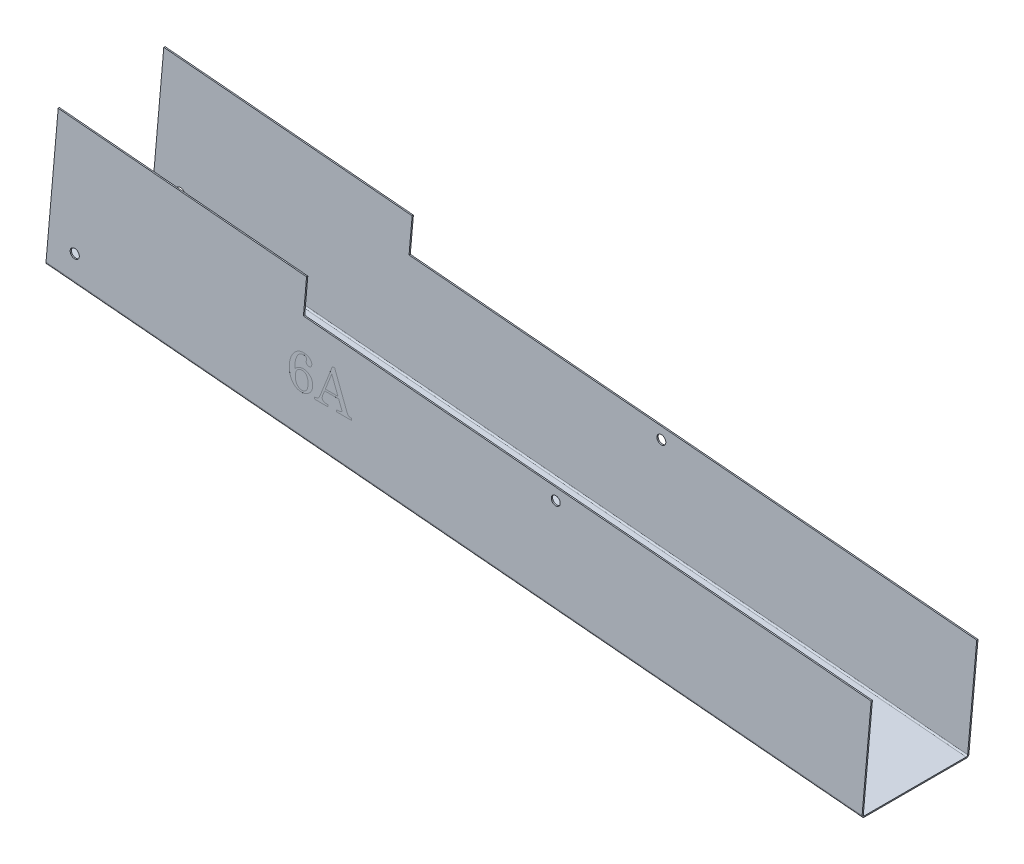
from build123d import *

# Parameters (mm, degrees)
BOSS_EXTRUDE1_DEPTH  = 38.1
CONVERT_SOLID1_START = -55.710785074
CONVERT_SOLID1_DEPTH = 584.2
SKETCH7_R            = 3.2639
CUT_EXTRUDE1_DEPTH   = 546.036793039
SKETCH8_R            = 3.175
CUT_EXTRUDE2_DEPTH   = 546.036793039
CUT_EXTRUDE3_DEPTH   = 0.00254
CUT_EXTRUDE4_DEPTH   = 0.00254


# Read off the part's stored shape, not the designer's step: Convert-Solid1
with BuildPart() as part:
    # Sketch1 → Boss-Extrude1 (new, symmetric)
    with BuildSketch(Plane.XY):
        Polygon((-47.909661455, 91.599636392), (-56.764684918, -9.613744934), (525.212257707, -60.530129847), (531.853525304, 15.379906147), (127, 50.8), (129.213755866, 76.103345332), align=None)
    extrude(amount=BOSS_EXTRUDE1_DEPTH, both=True)

    # Convert-Solid1 outline → Convert-Solid1 (cut)
    with BuildSketch(Plane(origin=(0, 0, 0), x_dir=(0.08715574274766531, 0.9961946980917449, 0), z_dir=(0.996194698091745, -0.0871557427476653, 0)).offset(CONVERT_SOLID1_START)):
        with BuildLine():
            Line((-14.524530008, -38.1), (-12.624530008, -38.1))
            ThreePointArc((-12.624530008, -38.1), (-13.968032892, -37.543502884), (-14.524530008, -36.2))
            Line((-14.524530008, -36.2), (-14.524530008, -38.1))
        make_face()
        with BuildLine():
            Line((-14.524530008, 38.1), (-14.524530008, 36.2))
            ThreePointArc((-14.524530008, 36.2), (-13.968032892, 37.543502884), (-12.624530008, 38.1))
            Line((-12.624530008, 38.1), (-14.524530008, 38.1))
        make_face()
        with BuildLine():
            Line((87.075469992, 37.2), (-12.624530008, 37.2))
            ThreePointArc((-12.624530008, 37.2), (-13.331636789, 36.907106781), (-13.624530008, 36.2))
            Line((-13.624530008, 36.2), (-13.624530008, -36.2))
            ThreePointArc((-13.624530008, -36.2), (-13.331636789, -36.907106781), (-12.624530008, -37.2))
            Line((-12.624530008, -37.2), (87.075469992, -37.2))
            Line((87.075469992, -37.2), (87.075469992, 37.2))
        make_face()
    extrude(amount=CONVERT_SOLID1_DEPTH, mode=Mode.SUBTRACT)

    # Sketch7 → Cut-Extrude1 (cut, through all)
    with BuildSketch(Plane.XY.offset(38.1)):
        with Locations((-36.12685902, 7.703447165)):
            Circle(SKETCH7_R)
    extrude(amount=-CUT_EXTRUDE1_DEPTH, mode=Mode.SUBTRACT)

    # Sketch8 → Cut-Extrude2 (cut, through all)
    with BuildSketch(Plane.XY.offset(38.1)):
        with Locations((306.935346231, 26.643679159)):
            Circle(SKETCH8_R)
    extrude(amount=-CUT_EXTRUDE2_DEPTH, mode=Mode.SUBTRACT)

    # Sketch9 → Cut-Extrude3 (cut)
    # profile 1 of 2: a face of its own
    with BuildSketch(Plane.XY.offset(38.1)):
        with BuildLine():
            add(Edge.make_bspline(
                [(120.89433467, 15.089818668), (121.114088216, 15.345842173), (121.538987526, 15.84087041), (122.239142865, 16.478252848), (122.947738879, 17.012514754), (123.685172025, 17.424471298), (124.448056146, 17.737639932), (125.244133896, 17.954884337), (126.074937094, 18.098576279), (126.642739319, 18.111886686), (126.931063967, 18.118645585)],
                knots=[0, 0, 0, 0, 1.15518856, 2.233587714, 3.237434965, 4.189814948, 5.119660525, 6.056163246, 7.012937916, 8, 8, 8, 8], degree=3))
            add(Edge.make_bspline(
                [(126.931063967, 18.118645585), (127.163238148, 18.112284528), (127.620591221, 18.099754068), (128.29214448, 18.010660977), (128.932918228, 17.85788295), (129.545550895, 17.648311787), (130.12936233, 17.374335257), (130.684310045, 17.038368848), (131.209872932, 16.643910291), (131.699402491, 16.194529218), (132.148553243, 15.700862071), (132.540479297, 15.167432489), (132.874213134, 14.601651518), (133.146086261, 14.005552071), (133.356564242, 13.37582201), (133.508305237, 12.71563057), (133.597815675, 12.021595347), (133.610164696, 11.548600634), (133.61645395, 11.307708372)],
                knots=[0, 0, 0, 0, 1.044483906, 2.057498042, 3.041291563, 4.003930521, 4.965577941, 5.937000168, 6.91766058, 7.91718785, 8.922517361, 9.915774843, 10.889917702, 11.872928882, 12.857847881, 13.872197807, 14.916328091, 16, 16, 16, 16], degree=3))
            add(Edge.make_bspline(
                [(133.61645395, 11.307708372), (133.609686304, 11.017895276), (133.596385906, 10.448328055), (133.483616416, 9.61279963), (133.301132484, 8.813883659), (133.045838083, 8.052003737), (132.710298625, 7.331231644), (132.315625768, 6.64081832), (131.8332376, 5.995787294), (131.288239774, 5.393593114), (130.690518139, 4.847402727), (130.052725185, 4.367876698), (129.382722594, 3.955558889), (128.672045171, 3.626901354), (127.92937851, 3.36772925), (127.150897581, 3.185953045), (126.338023915, 3.073225948), (125.784071212, 3.059794099), (125.502964228, 3.052978017)],
                knots=[0, 0, 0, 0, 1.07530773, 2.113293164, 3.12278084, 4.113357206, 5.089279015, 6.06946209, 7.059700115, 8.072336363, 9.080183726, 10.060046246, 11.030156511, 11.994333323, 12.960419743, 13.944696705, 14.957022674, 16, 16, 16, 16], degree=3))
            add(Edge.make_bspline(
                [(125.502964228, 3.052978017), (125.304061517, 3.057454939), (124.908926153, 3.066348686), (124.324681697, 3.123431469), (123.756354494, 3.223199846), (123.205251831, 3.364469743), (122.672483705, 3.548125618), (122.154554857, 3.769465775), (121.655023023, 4.030885581), (121.168837033, 4.328423089), (120.708922701, 4.678109496), (120.263810831, 5.063060629), (119.840877966, 5.496050146), (119.448244789, 5.978187153), (119.066250246, 6.499042192), (118.71286809, 7.068173056), (118.38559757, 7.684367309), (118.068548348, 8.335418597), (117.790022952, 9.028342888), (117.54227243, 9.750379894), (117.338828372, 10.502308298), (117.173384272, 11.283468466), (117.035734652, 12.09094296), (116.941694516, 12.927457627), (116.89120147, 13.791866187), (116.881670292, 14.378323006), (116.876823319, 14.676559037)],
                knots=[0, 0, 0, 0, 0.883664919, 1.755467568, 2.604957291, 3.444820255, 4.280205446, 5.10616279, 5.944667041, 6.78306393, 7.635198672, 8.508239482, 9.395699299, 10.320121956, 11.268418048, 12.263647801, 13.293052967, 14.36716297, 15.479155568, 16.608498161, 17.756732724, 18.93730736, 20.154818251, 21.394408002, 22.674955442, 24, 24, 24, 24], degree=3))
            add(Edge.make_bspline(
                [(116.876823319, 14.676559037), (116.879795062, 14.999310792), (116.885682298, 15.638705063), (116.964354993, 16.58458207), (117.076561814, 17.508641461), (117.239549394, 18.409711468), (117.447659024, 19.288560268), (117.70547884, 20.14408514), (118.007541987, 20.976273219), (118.359398486, 21.779578654), (118.742311348, 22.548520564), (119.156679594, 23.273169608), (119.595775586, 23.946767655), (120.054859622, 24.575152907), (120.550070596, 25.143488446), (121.062833494, 25.672377905), (121.606648962, 26.146162918), (122.171958031, 26.573044987), (122.757389031, 26.939072232), (123.345664192, 27.267979694), (123.942631825, 27.546846434), (124.548402267, 27.771132326), (125.159184512, 27.944228183), (125.774104456, 28.072129569), (126.397429482, 28.145846084), (126.815794682, 28.156893654), (127.025224389, 28.162423964)],
                knots=[0, 0, 0, 0, 1.243152028, 2.46277293, 3.654372621, 4.828515876, 5.988718833, 7.132190138, 8.269229334, 9.397502021, 10.509151182, 11.577424797, 12.611608541, 13.605920474, 14.572893715, 15.513533556, 16.441930275, 17.348883295, 18.239769449, 19.09980024, 19.944394787, 20.775522359, 21.585751549, 22.388144142, 23.193120032, 24, 24, 24, 24], degree=3))
            add(Edge.make_bspline(
                [(127.025224389, 28.162423964), (127.238174697, 28.1591137), (127.656494255, 28.152611019), (128.27159921, 28.080233526), (128.862173988, 27.974474479), (129.427448228, 27.815460512), (129.967153936, 27.609857442), (130.484481983, 27.365642764), (130.977785124, 27.076365615), (131.281908372, 26.84888696), (131.435070833, 26.734324226)],
                knots=[0, 0, 0, 0, 1.081133678, 2.12377886, 3.141755168, 4.125997766, 5.101473931, 6.072112995, 7.02907811, 8, 8, 8, 8], degree=3))
            add(Edge.make_bspline(
                [(131.435070833, 26.734324226), (131.556118645, 26.637674953), (131.791012042, 26.450126944), (132.093665211, 26.130511832), (132.359338027, 25.806834142), (132.57721842, 25.465780445), (132.738194152, 25.104665569), (132.862683979, 24.732512785), (132.92905444, 24.342537395), (132.940903712, 24.078864435), (132.946868725, 23.946129499)],
                knots=[0, 0, 0, 0, 1.127905394, 2.18870153, 3.201176125, 4.178074235, 5.128053522, 6.076756242, 7.031824741, 8, 8, 8, 8], degree=3))
            add(Edge.make_bspline(
                [(132.946868725, 23.946129499), (132.940934165, 23.772757525), (132.929459535, 23.437538185), (132.809857183, 22.959684222), (132.622032994, 22.528966739), (132.359386265, 22.156225366), (132.041755783, 21.853445533), (131.686041661, 21.626813492), (131.291524368, 21.487637331), (131.015954788, 21.473689099), (130.875339434, 21.466571712)],
                knots=[0, 0, 0, 0, 1.153726211, 2.230760421, 3.261177434, 4.270660677, 5.249146575, 6.168386457, 7.065379467, 8, 8, 8, 8], degree=3))
            add(Edge.make_bspline(
                [(130.875339434, 21.466571712), (130.745421838, 21.473205795), (130.489441424, 21.486277121), (130.123644536, 21.602352262), (129.783907126, 21.78179695), (129.490802603, 22.041273433), (129.242868395, 22.342459386), (129.057804204, 22.680395021), (128.951365556, 23.047000786), (128.936743618, 23.300295722), (128.929357373, 23.428247176)],
                knots=[0, 0, 0, 0, 1.014689736, 1.999272662, 2.976541523, 4.002645451, 5.040935778, 6.018204639, 6.998899853, 8, 8, 8, 8], degree=3))
            add(Edge.make_bspline(
                [(128.929357373, 23.428247176), (128.937531178, 23.61911687), (128.954945449, 24.025764249), (129.051010302, 24.421448019), (129.101984814, 24.631408128)],
                knots=[0, 0, 0, 0, 0.938747937, 2, 2, 2, 2], degree=3))
            add(Edge.make_bspline(
                [(129.101984814, 24.631408128), (129.128139219, 24.728686237), (129.177312618, 24.91158068), (129.220288065, 25.173132084), (129.257050947, 25.399394124), (129.261911749, 25.539763682), (129.264149986, 25.604399158)],
                knots=[0, 0, 0, 0, 1.221676289, 2.296897074, 3.215778188, 4, 4, 4, 4], degree=3))
            add(Edge.make_bspline(
                [(129.264149986, 25.604399158), (129.260239071, 25.683868784), (129.252494311, 25.841241978), (129.155915195, 26.059883442), (129.008694851, 26.258592567), (128.874930162, 26.360854425), (128.803810143, 26.415225017)],
                knots=[0, 0, 0, 0, 0.975009045, 1.930804205, 2.899849836, 4, 4, 4, 4], degree=3))
            add(Edge.make_bspline(
                [(128.803810143, 26.415225017), (128.694040529, 26.478382471), (128.464525254, 26.610437235), (128.063622259, 26.738987531), (127.606622277, 26.808198673), (127.283547461, 26.81807512), (127.114153677, 26.823253514)],
                knots=[0, 0, 0, 0, 0.860759205, 1.799745656, 2.846368109, 4, 4, 4, 4], degree=3))
            add(Edge.make_bspline(
                [(127.114153677, 26.823253514), (126.842478379, 26.812682502), (126.305474194, 26.791787421), (125.52393702, 26.578232915), (124.775576183, 26.253866271), (124.195066778, 25.866797314), (123.750323222, 25.495986708), (123.429501375, 25.161431408), (123.123489829, 24.780346822), (122.829315951, 24.35297439), (122.547689992, 23.88055804), (122.273808486, 23.361640789), (122.021011662, 22.792264893), (121.697322407, 21.96867417), (121.348902277, 20.869822693), (121.054298255, 19.475479799), (120.871628266, 18.001446734), (120.852051293, 16.9927546), (120.842023324, 16.47606933)],
                knots=[0, 0, 0, 0, 0.971688549, 1.920678183, 2.88340009, 3.885392209, 4.408774106, 4.956875509, 5.543534456, 6.159017994, 6.815026857, 7.513966368, 8.260917618, 9.046686804, 10.685410247, 12.385720898, 14.148647427, 16, 16, 16, 16], degree=3))
            add(Edge.make_bspline(
                [(120.842023324, 16.47606933), (120.843519451, 16.388877473), (120.846811567, 16.197018209), (120.858210949, 15.879669817), (120.873722498, 15.50475786), (120.887145755, 15.234537162), (120.89433467, 15.089818668)],
                knots=[0, 0, 0, 0, 0.754292582, 1.659765325, 2.74667174, 4, 4, 4, 4], degree=3))
        make_face()
        with BuildLine():
            add(Edge.make_bspline(
                [(126.026077686, 16.779475135), (125.854902559, 16.774308519), (125.517943655, 16.764138016), (125.023958287, 16.687928154), (124.551939118, 16.571718788), (124.10565542, 16.39362446), (123.683148695, 16.171247458), (123.287322107, 15.893874221), (122.912819959, 15.572690993), (122.565004715, 15.203346794), (122.248748804, 14.789144223), (121.979085552, 14.330231455), (121.739319201, 13.837515065), (121.553371588, 13.299321711), (121.407532431, 12.723409035), (121.303834923, 12.107643488), (121.240246332, 11.452037247), (121.232904463, 11.000965095), (121.229127283, 10.768901511)],
                knots=[0, 0, 0, 0, 0.949075543, 1.868258902, 2.766701683, 3.639584075, 4.526552555, 5.40923933, 6.314579547, 7.258763553, 8.218230028, 9.198529645, 10.206493817, 11.252665883, 12.350497027, 13.498519192, 14.713060431, 16, 16, 16, 16], degree=3))
            add(Edge.make_bspline(
                [(121.229127283, 10.768901511), (121.232749537, 10.517649445), (121.239779729, 10.030011014), (121.30516682, 9.322720062), (121.401798309, 8.65971962), (121.542090852, 8.041833853), (121.724073329, 7.46865906), (121.949920046, 6.943837268), (122.212280471, 6.462369512), (122.514301665, 6.029169454), (122.851721578, 5.645596454), (123.211928673, 5.309606024), (123.595871941, 5.0245511), (124.001398316, 4.792589912), (124.429621987, 4.611551014), (124.882162154, 4.4890596), (125.355218696, 4.406111839), (125.678716257, 4.396851074), (125.842987976, 4.392148468)],
                knots=[0, 0, 0, 0, 1.364103527, 2.647497837, 3.854117083, 5.000370457, 6.084428247, 7.115189779, 8.098401111, 9.057233799, 9.976535432, 10.867705672, 11.727535847, 12.567318146, 13.399161598, 14.244637041, 15.108628548, 16, 16, 16, 16], degree=3))
            add(Edge.make_bspline(
                [(125.842987976, 4.392148468), (126.00544655, 4.397281487), (126.323338108, 4.407325545), (126.788167355, 4.483037976), (127.228797586, 4.60256894), (127.646930508, 4.769611707), (128.036143754, 4.993838658), (128.404089562, 5.260661072), (128.745622388, 5.57744355), (129.061438817, 5.941976285), (129.349842295, 6.353393312), (129.594855368, 6.818786296), (129.803798756, 7.328787751), (129.977021702, 7.885022026), (130.105756984, 8.49123243), (130.197838849, 9.143227635), (130.256553463, 9.843677169), (130.264445025, 10.325877272), (130.268527824, 10.575349532)],
                knots=[0, 0, 0, 0, 0.909396033, 1.779464838, 2.629860702, 3.462124791, 4.29295567, 5.138629575, 6.002374521, 6.895212095, 7.835129073, 8.809266767, 9.833779316, 10.917798107, 12.066925648, 13.300059089, 14.603151772, 16, 16, 16, 16], degree=3))
            add(Edge.make_bspline(
                [(130.268527824, 10.575349532), (130.266169319, 10.83874703), (130.261618983, 11.346928015), (130.208509273, 12.082189126), (130.122185612, 12.762214572), (129.997104982, 13.384344116), (129.841473688, 13.950482474), (129.6480721, 14.46066289), (129.420861428, 14.916567413), (129.154404219, 15.314890708), (128.860622905, 15.663644687), (128.534544894, 15.963092807), (128.182647247, 16.215046988), (127.803990565, 16.423842221), (127.397611977, 16.584022361), (126.964235824, 16.699784395), (126.504393924, 16.769561835), (126.188494273, 16.776108985), (126.026077686, 16.779475135)],
                knots=[0, 0, 0, 0, 1.481997958, 2.859264748, 4.145766163, 5.336979382, 6.427417082, 7.446135251, 8.402802757, 9.287300334, 10.136644771, 10.963063103, 11.771815852, 12.566698608, 13.39031591, 14.223406735, 15.086582672, 16, 16, 16, 16], degree=3))
        make_face(mode=Mode.SUBTRACT)
    # profile 2 of 2: a face of its own
    with BuildSketch(Plane.XY.offset(38.1)):
        with BuildLine():
            Line((147.667281411, 29.836387027), (149.252315186, 29.836387027))
            Line((149.252315186, 29.836387027), (158.281253458, 6.191658761))
            add(Edge.make_bspline(
                [(158.281253458, 6.191658761), (158.331763824, 6.074710298), (158.428767939, 5.850113185), (158.629710333, 5.549230252), (158.862347869, 5.289883042), (159.141675612, 5.086518511), (159.448382854, 4.916329442), (159.80059728, 4.8143571), (160.183515277, 4.734026653), (160.453420453, 4.729361041), (160.593414939, 4.72694108)],
                knots=[0, 0, 0, 0, 1.039787226, 1.996889935, 2.945563617, 3.872445737, 4.810232727, 5.797866669, 6.857796924, 8, 8, 8, 8], degree=3))
            Line((160.593414939, 4.72694108), (161.404240798, 4.72694108))
            Line((161.404240798, 4.72694108), (161.404240798, 3.38777063))
            Line((161.404240798, 3.38777063), (150.690877194, 3.38777063))
            Line((150.690877194, 3.38777063), (150.690877194, 4.72694108))
            Line((150.690877194, 4.72694108), (151.543552129, 4.72694108))
            add(Edge.make_bspline(
                [(151.543552129, 4.72694108), (151.801931058, 4.729449204), (152.279632334, 4.734086322), (152.932993426, 4.803538), (153.472887149, 4.898148272), (153.773491061, 5.025612295), (153.908024956, 5.082658231)],
                knots=[0, 0, 0, 0, 1.28614417, 2.377874675, 3.274025287, 4, 4, 4, 4], degree=3))
            add(Edge.make_bspline(
                [(153.908024956, 5.082658231), (153.978625849, 5.126311345), (154.115739961, 5.211090129), (154.27386224, 5.392429707), (154.360013044, 5.614663137), (154.372403013, 5.770720891), (154.378827067, 5.851635013)],
                knots=[0, 0, 0, 0, 1.044845995, 2.029197152, 2.978161746, 4, 4, 4, 4], degree=3))
            add(Edge.make_bspline(
                [(154.378827067, 5.851635013), (154.373122039, 5.957203687), (154.361191286, 6.177976232), (154.286844472, 6.386337281), (154.248048703, 6.495064566)],
                knots=[0, 0, 0, 0, 0.9563569, 2, 2, 2, 2], degree=3))
            Line((154.248048703, 6.495064566), (152.108514663, 12.092378558))
            Line((152.108514663, 12.092378558), (142.080429688, 12.092378558))
            Line((142.080429688, 12.092378558), (140.814495121, 8.880461931))
            add(Edge.make_bspline(
                [(140.814495121, 8.880461931), (140.743916929, 8.678988642), (140.611781776, 8.301794174), (140.464251816, 7.760425611), (140.367329394, 7.284876553), (140.351118004, 6.987145699), (140.34369301, 6.850781717)],
                knots=[0, 0, 0, 0, 1.224040328, 2.291625076, 3.217545626, 4, 4, 4, 4], degree=3))
            add(Edge.make_bspline(
                [(140.34369301, 6.850781717), (140.354056748, 6.708230254), (140.374467429, 6.427484811), (140.530897566, 6.023157524), (140.791170979, 5.660290872), (141.138973477, 5.325895431), (141.589660711, 5.05327409), (142.13479711, 4.864434332), (142.76546428, 4.741116618), (143.216667112, 4.731857107), (143.45621808, 4.72694108)],
                knots=[0, 0, 0, 0, 0.81354721, 1.602226087, 2.440081589, 3.349586742, 4.342853265, 5.424428202, 6.632586778, 8, 8, 8, 8], degree=3))
            Line((143.45621808, 4.72694108), (144.329817554, 4.72694108))
            Line((144.329817554, 4.72694108), (144.329817554, 3.38777063))
            Line((144.329817554, 3.38777063), (134.9556244, 3.38777063))
            Line((134.9556244, 3.38777063), (134.9556244, 4.72694108))
            add(Edge.make_bspline(
                [(134.9556244, 4.72694108), (135.198613629, 4.734080283), (135.662028285, 4.747695748), (136.318459585, 4.874072376), (136.897708662, 5.080370234), (137.409285025, 5.385972702), (137.866980605, 5.81655579), (138.276144723, 6.394067359), (138.684889284, 7.106684976), (138.909831112, 7.648028061), (139.030678232, 7.938857708)],
                knots=[0, 0, 0, 0, 1.036060294, 1.975912788, 2.839911673, 3.647735987, 4.500737518, 5.500873586, 6.657376306, 8, 8, 8, 8], degree=3))
            Line((139.030678232, 7.938857708), (147.667281411, 29.836387027))
        make_face()
        Polygon((147.175554761, 25.013280952), (142.60877428, 13.431549009), (151.595863475, 13.431549009), align=None, mode=Mode.SUBTRACT)
    extrude(amount=-CUT_EXTRUDE3_DEPTH, mode=Mode.SUBTRACT)

    # Sketch10 → Cut-Extrude4 (cut)
    # profile 1 of 2: a face of its own
    with BuildSketch(Plane(origin=(0, 0, -38.1), x_dir=(-1, 0, 0), z_dir=(0, 0, -1))):
        with BuildLine():
            add(Edge.make_bspline(
                [(-155.278783024, 13.635392643), (-155.059029478, 13.891416148), (-154.634130169, 14.386444385), (-153.93397483, 15.023826823), (-153.225378815, 15.558088729), (-152.48794567, 15.970045273), (-151.725061548, 16.283213907), (-150.928983798, 16.500458312), (-150.098180601, 16.644150254), (-149.530378376, 16.65746066), (-149.242053728, 16.66421956)],
                knots=[0, 0, 0, 0, 1.15518856, 2.233587714, 3.237434965, 4.189814948, 5.119660525, 6.056163246, 7.012937916, 8, 8, 8, 8], degree=3))
            add(Edge.make_bspline(
                [(-149.242053728, 16.66421956), (-149.009879546, 16.657858503), (-148.552526473, 16.645328043), (-147.880973214, 16.556234952), (-147.240199466, 16.403456924), (-146.6275668, 16.193885761), (-146.043755365, 15.919909232), (-145.488807649, 15.583942823), (-144.963244762, 15.189484266), (-144.473715204, 14.740103193), (-144.024564452, 14.246436046), (-143.632638397, 13.713006464), (-143.298904561, 13.147225493), (-143.027031434, 12.551126046), (-142.816553452, 11.921395985), (-142.664812457, 11.261204545), (-142.57530202, 10.567169322), (-142.562952998, 10.094174609), (-142.556663745, 9.853282347)],
                knots=[0, 0, 0, 0, 1.044483906, 2.057498042, 3.041291563, 4.003930521, 4.965577941, 5.937000168, 6.91766058, 7.91718785, 8.922517361, 9.915774843, 10.889917702, 11.872928882, 12.857847881, 13.872197807, 14.916328091, 16, 16, 16, 16], degree=3))
            add(Edge.make_bspline(
                [(-142.556663745, 9.853282347), (-142.563431391, 9.56346925), (-142.576731788, 8.993902029), (-142.689501278, 8.158373604), (-142.871985211, 7.359457634), (-143.127279612, 6.597577711), (-143.462819069, 5.876805619), (-143.857491927, 5.186392295), (-144.339880094, 4.541361269), (-144.88487792, 3.939167089), (-145.482599555, 3.392976702), (-146.120392509, 2.913450672), (-146.7903951, 2.501132864), (-147.501072524, 2.172475329), (-148.243739185, 1.913303225), (-149.022220113, 1.73152702), (-149.83509378, 1.618799923), (-150.389046483, 1.605368073), (-150.670153466, 1.598551992)],
                knots=[0, 0, 0, 0, 1.07530773, 2.113293164, 3.12278084, 4.113357206, 5.089279015, 6.06946209, 7.059700115, 8.072336363, 9.080183726, 10.060046246, 11.030156511, 11.994333323, 12.960419743, 13.944696705, 14.957022674, 16, 16, 16, 16], degree=3))
            add(Edge.make_bspline(
                [(-150.670153466, 1.598551992), (-150.869056178, 1.603028914), (-151.264191542, 1.611922661), (-151.848435998, 1.669005444), (-152.4167632, 1.768773821), (-152.967865863, 1.910043718), (-153.500633989, 2.093699592), (-154.018562837, 2.31503975), (-154.518094671, 2.576459556), (-155.004280661, 2.873997064), (-155.464194993, 3.22368347), (-155.909306863, 3.608634603), (-156.332239729, 4.04162412), (-156.724872905, 4.523761127), (-157.106867449, 5.044616167), (-157.460249604, 5.61374703), (-157.787520124, 6.229941283), (-158.104569346, 6.880992571), (-158.383094742, 7.573916863), (-158.630845265, 8.295953868), (-158.834289322, 9.047882273), (-158.999733422, 9.82904244), (-159.137383043, 10.636516935), (-159.231423178, 11.473031601), (-159.281916224, 12.337440161), (-159.291447402, 12.92389698), (-159.296294376, 13.222133011)],
                knots=[0, 0, 0, 0, 0.883664919, 1.755467568, 2.604957291, 3.444820255, 4.280205446, 5.10616279, 5.944667041, 6.78306393, 7.635198672, 8.508239482, 9.395699299, 10.320121956, 11.268418048, 12.263647801, 13.293052967, 14.36716297, 15.479155568, 16.608498161, 17.756732724, 18.93730736, 20.154818251, 21.394408002, 22.674955442, 24, 24, 24, 24], degree=3))
            add(Edge.make_bspline(
                [(-159.296294376, 13.222133011), (-159.293322632, 13.544884766), (-159.287435396, 14.184279038), (-159.208762701, 15.130156045), (-159.09655588, 16.054215436), (-158.9335683, 16.955285443), (-158.72545867, 17.834134243), (-158.467638855, 18.689659115), (-158.165575708, 19.521847194), (-157.813719208, 20.325152629), (-157.430806346, 21.094094538), (-157.0164381, 21.818743583), (-156.577342109, 22.492341629), (-156.118258073, 23.120726881), (-155.623047099, 23.689062421), (-155.1102842, 24.21795188), (-154.566468733, 24.691736893), (-154.001159663, 25.118618962), (-153.415728663, 25.484646207), (-152.827453502, 25.813553669), (-152.230485869, 26.092420408), (-151.624715428, 26.316706301), (-151.013933183, 26.489802158), (-150.399013239, 26.617703544), (-149.775688212, 26.691420059), (-149.357323012, 26.702467629), (-149.147893306, 26.707997939)],
                knots=[0, 0, 0, 0, 1.243152028, 2.46277293, 3.654372621, 4.828515876, 5.988718833, 7.132190138, 8.269229334, 9.397502021, 10.509151182, 11.577424797, 12.611608541, 13.605920474, 14.572893715, 15.513533556, 16.441930275, 17.348883295, 18.239769449, 19.09980024, 19.944394787, 20.775522359, 21.585751549, 22.388144142, 23.193120032, 24, 24, 24, 24], degree=3))
            add(Edge.make_bspline(
                [(-149.147893306, 26.707997939), (-148.934942998, 26.704687675), (-148.51662344, 26.698184993), (-147.901518484, 26.6258075), (-147.310943706, 26.520048454), (-146.745669466, 26.361034486), (-146.205963759, 26.155431417), (-145.688635712, 25.911216738), (-145.19533257, 25.62193959), (-144.891209322, 25.394460935), (-144.738046861, 25.279898201)],
                knots=[0, 0, 0, 0, 1.081133678, 2.12377886, 3.141755168, 4.125997766, 5.101473931, 6.072112995, 7.02907811, 8, 8, 8, 8], degree=3))
            add(Edge.make_bspline(
                [(-144.738046861, 25.279898201), (-144.61699905, 25.183248928), (-144.382105652, 24.995700919), (-144.079452483, 24.676085806), (-143.813779668, 24.352408117), (-143.595899275, 24.01135442), (-143.434923543, 23.650239543), (-143.310433715, 23.27808676), (-143.244063255, 22.88811137), (-143.232213982, 22.624438409), (-143.22624897, 22.491703474)],
                knots=[0, 0, 0, 0, 1.127905394, 2.18870153, 3.201176125, 4.178074235, 5.128053522, 6.076756242, 7.031824741, 8, 8, 8, 8], degree=3))
            add(Edge.make_bspline(
                [(-143.22624897, 22.491703474), (-143.23218353, 22.318331499), (-143.24365816, 21.98311216), (-143.363260511, 21.505258197), (-143.551084701, 21.074540714), (-143.813731429, 20.701799341), (-144.131361911, 20.399019507), (-144.487076034, 20.172387466), (-144.881593327, 20.033211306), (-145.157162906, 20.019263074), (-145.29777826, 20.012145686)],
                knots=[0, 0, 0, 0, 1.153726211, 2.230760421, 3.261177434, 4.270660677, 5.249146575, 6.168386457, 7.065379467, 8, 8, 8, 8], degree=3))
            add(Edge.make_bspline(
                [(-145.29777826, 20.012145686), (-145.427695857, 20.018779769), (-145.683676271, 20.031851096), (-146.049473158, 20.147926237), (-146.389210569, 20.327370925), (-146.682315092, 20.586847408), (-146.930249299, 20.88803336), (-147.11531349, 21.225968995), (-147.221752138, 21.592574761), (-147.236374077, 21.845869697), (-147.243760321, 21.973821151)],
                knots=[0, 0, 0, 0, 1.014689736, 1.999272662, 2.976541523, 4.002645451, 5.040935778, 6.018204639, 6.998899853, 8, 8, 8, 8], degree=3))
            add(Edge.make_bspline(
                [(-147.243760321, 21.973821151), (-147.235586516, 22.164690845), (-147.218172246, 22.571338224), (-147.122107392, 22.967021994), (-147.07113288, 23.176982103)],
                knots=[0, 0, 0, 0, 0.938747937, 2, 2, 2, 2], degree=3))
            add(Edge.make_bspline(
                [(-147.07113288, 23.176982103), (-147.044978476, 23.274260212), (-146.995805077, 23.457154654), (-146.95282963, 23.718706059), (-146.916066747, 23.944968099), (-146.911205945, 24.085337657), (-146.908967709, 24.149973133)],
                knots=[0, 0, 0, 0, 1.221676289, 2.296897074, 3.215778188, 4, 4, 4, 4], degree=3))
            add(Edge.make_bspline(
                [(-146.908967709, 24.149973133), (-146.912878624, 24.229442759), (-146.920623384, 24.386815952), (-147.017202499, 24.605457417), (-147.164422843, 24.804166542), (-147.298187532, 24.9064284), (-147.369307551, 24.960798992)],
                knots=[0, 0, 0, 0, 0.975009045, 1.930804205, 2.899849836, 4, 4, 4, 4], degree=3))
            add(Edge.make_bspline(
                [(-147.369307551, 24.960798992), (-147.479077165, 25.023956446), (-147.708592441, 25.15601121), (-148.109495435, 25.284561505), (-148.566495418, 25.353772648), (-148.889570233, 25.363649094), (-149.058964018, 25.368827488)],
                knots=[0, 0, 0, 0, 0.860759205, 1.799745656, 2.846368109, 4, 4, 4, 4], degree=3))
            add(Edge.make_bspline(
                [(-149.058964018, 25.368827488), (-149.330639315, 25.358256477), (-149.8676435, 25.337361396), (-150.649180674, 25.12380689), (-151.397541511, 24.799440246), (-151.978050917, 24.412371289), (-152.422794473, 24.041560683), (-152.743616319, 23.707005383), (-153.049627865, 23.325920796), (-153.343801743, 22.898548364), (-153.625427702, 22.426132014), (-153.899309208, 21.907214764), (-154.152106032, 21.337838867), (-154.475795287, 20.514248145), (-154.824215417, 19.415396667), (-155.11881944, 18.021053774), (-155.301489429, 16.547020709), (-155.321066401, 15.538328575), (-155.33109437, 15.021643304)],
                knots=[0, 0, 0, 0, 0.971688549, 1.920678183, 2.88340009, 3.885392209, 4.408774106, 4.956875509, 5.543534456, 6.159017994, 6.815026857, 7.513966368, 8.260917618, 9.046686804, 10.685410247, 12.385720898, 14.148647427, 16, 16, 16, 16], degree=3))
            add(Edge.make_bspline(
                [(-155.33109437, 15.021643304), (-155.329598244, 14.934451448), (-155.326306128, 14.742592183), (-155.314906745, 14.425243792), (-155.299395197, 14.050331835), (-155.285971939, 13.780111137), (-155.278783024, 13.635392643)],
                knots=[0, 0, 0, 0, 0.754292582, 1.659765325, 2.74667174, 4, 4, 4, 4], degree=3))
        make_face()
        with BuildLine():
            add(Edge.make_bspline(
                [(-150.147040009, 15.32504911), (-150.318215136, 15.319882494), (-150.655174039, 15.309711991), (-151.149159407, 15.233502129), (-151.621178576, 15.117292763), (-152.067462274, 14.939198435), (-152.489969, 14.716821433), (-152.885795588, 14.439448196), (-153.260297735, 14.118264968), (-153.608112979, 13.748920768), (-153.924368891, 13.334718198), (-154.194032143, 12.87580543), (-154.433798494, 12.38308904), (-154.619746107, 11.844895685), (-154.765585263, 11.268983009), (-154.869282771, 10.653217463), (-154.932871362, 9.997611222), (-154.940213232, 9.54653907), (-154.943990412, 9.314475486)],
                knots=[0, 0, 0, 0, 0.949075543, 1.868258902, 2.766701683, 3.639584075, 4.526552555, 5.40923933, 6.314579547, 7.258763553, 8.218230028, 9.198529645, 10.206493817, 11.252665883, 12.350497027, 13.498519192, 14.713060431, 16, 16, 16, 16], degree=3))
            add(Edge.make_bspline(
                [(-154.943990412, 9.314475486), (-154.940368157, 9.063223419), (-154.933337965, 8.575584989), (-154.867950875, 7.868294037), (-154.771319385, 7.205293595), (-154.631026842, 6.587407827), (-154.449044365, 6.014233035), (-154.223197648, 5.489411243), (-153.960837223, 5.007943487), (-153.658816029, 4.574743429), (-153.321396116, 4.191170428), (-152.961189022, 3.855179998), (-152.577245753, 3.570125075), (-152.171719379, 3.338163887), (-151.743495708, 3.157124989), (-151.29095554, 3.034633575), (-150.817898998, 2.951685814), (-150.494401438, 2.942425049), (-150.330129719, 2.937722442)],
                knots=[0, 0, 0, 0, 1.364103527, 2.647497837, 3.854117083, 5.000370457, 6.084428247, 7.115189779, 8.098401111, 9.057233799, 9.976535432, 10.867705672, 11.727535847, 12.567318146, 13.399161598, 14.244637041, 15.108628548, 16, 16, 16, 16], degree=3))
            add(Edge.make_bspline(
                [(-150.330129719, 2.937722442), (-150.167671144, 2.942855461), (-149.849779587, 2.952899519), (-149.384950339, 3.028611951), (-148.944320108, 3.148142914), (-148.526187186, 3.315185682), (-148.13697394, 3.539412632), (-147.769028133, 3.806235047), (-147.427495307, 4.123017525), (-147.111678878, 4.48755026), (-146.823275399, 4.898967287), (-146.578262326, 5.364360271), (-146.369318938, 5.874361725), (-146.196095992, 6.430596001), (-146.067360711, 7.036806405), (-145.975278845, 7.68880161), (-145.916564232, 8.389251143), (-145.908672669, 8.871451247), (-145.904589871, 9.120923507)],
                knots=[0, 0, 0, 0, 0.909396033, 1.779464838, 2.629860702, 3.462124791, 4.29295567, 5.138629575, 6.002374521, 6.895212095, 7.835129073, 8.809266767, 9.833779316, 10.917798107, 12.066925648, 13.300059089, 14.603151772, 16, 16, 16, 16], degree=3))
            add(Edge.make_bspline(
                [(-145.904589871, 9.120923507), (-145.906948375, 9.384321005), (-145.911498712, 9.892501989), (-145.964608421, 10.6277631), (-146.050932082, 11.307788547), (-146.176012713, 11.929918091), (-146.331644006, 12.496056449), (-146.525045594, 13.006236864), (-146.752256267, 13.462141388), (-147.018713476, 13.860464682), (-147.312494789, 14.209218662), (-147.638572801, 14.508666782), (-147.990470448, 14.760620963), (-148.36912713, 14.969416196), (-148.775505717, 15.129596336), (-149.20888187, 15.24535837), (-149.668723771, 15.31513581), (-149.984623422, 15.321682959), (-150.147040009, 15.32504911)],
                knots=[0, 0, 0, 0, 1.481997958, 2.859264748, 4.145766163, 5.336979382, 6.427417082, 7.446135251, 8.402802757, 9.287300334, 10.136644771, 10.963063103, 11.771815852, 12.566698608, 13.39031591, 14.223406735, 15.086582672, 16, 16, 16, 16], degree=3))
        make_face(mode=Mode.SUBTRACT)
    # profile 2 of 2: a face of its own
    with BuildSketch(Plane(origin=(0, 0, -38.1), x_dir=(-1, 0, 0), z_dir=(0, 0, -1))):
        with BuildLine():
            Line((-128.505836283, 28.381961002), (-126.920802508, 28.381961002))
            Line((-126.920802508, 28.381961002), (-117.891864236, 4.737232735))
            add(Edge.make_bspline(
                [(-117.891864236, 4.737232735), (-117.841353871, 4.620284272), (-117.744349755, 4.39568716), (-117.543407361, 4.094804227), (-117.310769825, 3.835457016), (-117.031442082, 3.632092486), (-116.72473484, 3.461903416), (-116.372520414, 3.359931075), (-115.989602418, 3.279600627), (-115.719697241, 3.274935016), (-115.579702755, 3.272515055)],
                knots=[0, 0, 0, 0, 1.039787226, 1.996889935, 2.945563617, 3.872445737, 4.810232727, 5.797866669, 6.857796924, 8, 8, 8, 8], degree=3))
            Line((-115.579702755, 3.272515055), (-114.768876897, 3.272515055))
            Line((-114.768876897, 3.272515055), (-114.768876897, 1.933344605))
            Line((-114.768876897, 1.933344605), (-125.482240501, 1.933344605))
            Line((-125.482240501, 1.933344605), (-125.482240501, 3.272515055))
            Line((-125.482240501, 3.272515055), (-124.629565565, 3.272515055))
            add(Edge.make_bspline(
                [(-124.629565565, 3.272515055), (-124.371186637, 3.275023178), (-123.89348536, 3.279660297), (-123.240124268, 3.349111975), (-122.700230545, 3.443722247), (-122.399626634, 3.57118627), (-122.265092739, 3.628232206)],
                knots=[0, 0, 0, 0, 1.28614417, 2.377874675, 3.274025287, 4, 4, 4, 4], degree=3))
            add(Edge.make_bspline(
                [(-122.265092739, 3.628232206), (-122.194491846, 3.671885319), (-122.057377734, 3.756664104), (-121.899255454, 3.938003682), (-121.81310465, 4.160237112), (-121.800714681, 4.316294866), (-121.794290627, 4.397208988)],
                knots=[0, 0, 0, 0, 1.044845995, 2.029197152, 2.978161746, 4, 4, 4, 4], degree=3))
            add(Edge.make_bspline(
                [(-121.794290627, 4.397208988), (-121.799995656, 4.502777662), (-121.811926408, 4.723550207), (-121.886273222, 4.931911255), (-121.925068992, 5.04063854)],
                knots=[0, 0, 0, 0, 0.9563569, 2, 2, 2, 2], degree=3))
            Line((-121.925068992, 5.04063854), (-124.064603032, 10.637952533))
            Line((-124.064603032, 10.637952533), (-134.092688007, 10.637952533))
            Line((-134.092688007, 10.637952533), (-135.358622573, 7.426035905))
            add(Edge.make_bspline(
                [(-135.358622573, 7.426035905), (-135.429200766, 7.224562617), (-135.561335918, 6.847368149), (-135.708865878, 6.305999585), (-135.8057883, 5.830450527), (-135.821999691, 5.532719674), (-135.829424685, 5.396355691)],
                knots=[0, 0, 0, 0, 1.224040328, 2.291625076, 3.217545626, 4, 4, 4, 4], degree=3))
            add(Edge.make_bspline(
                [(-135.829424685, 5.396355691), (-135.819060946, 5.253804229), (-135.798650266, 4.973058786), (-135.642220129, 4.568731499), (-135.381946715, 4.205864846), (-135.034144217, 3.871469405), (-134.583456983, 3.598848065), (-134.038320585, 3.410008307), (-133.407653414, 3.286690593), (-132.956450583, 3.277431081), (-132.716899614, 3.272515055)],
                knots=[0, 0, 0, 0, 0.81354721, 1.602226087, 2.440081589, 3.349586742, 4.342853265, 5.424428202, 6.632586778, 8, 8, 8, 8], degree=3))
            Line((-132.716899614, 3.272515055), (-131.843300141, 3.272515055))
            Line((-131.843300141, 3.272515055), (-131.843300141, 1.933344605))
            Line((-131.843300141, 1.933344605), (-141.217493294, 1.933344605))
            Line((-141.217493294, 1.933344605), (-141.217493294, 3.272515055))
            add(Edge.make_bspline(
                [(-141.217493294, 3.272515055), (-140.974504065, 3.279654258), (-140.51108941, 3.293269723), (-139.854658109, 3.419646351), (-139.275409033, 3.625944209), (-138.763832669, 3.931546677), (-138.306137089, 4.362129765), (-137.896972972, 4.939641333), (-137.488228411, 5.652258951), (-137.263286582, 6.193602036), (-137.142439462, 6.484431682)],
                knots=[0, 0, 0, 0, 1.036060294, 1.975912788, 2.839911673, 3.647735987, 4.500737518, 5.500873586, 6.657376306, 8, 8, 8, 8], degree=3))
            Line((-137.142439462, 6.484431682), (-128.505836283, 28.381961002))
        make_face()
        Polygon((-128.997562933, 23.558854926), (-133.564343415, 11.977122983), (-124.57725422, 11.977122983), align=None, mode=Mode.SUBTRACT)
    extrude(amount=-CUT_EXTRUDE4_DEPTH, mode=Mode.SUBTRACT)


solid = part.part
